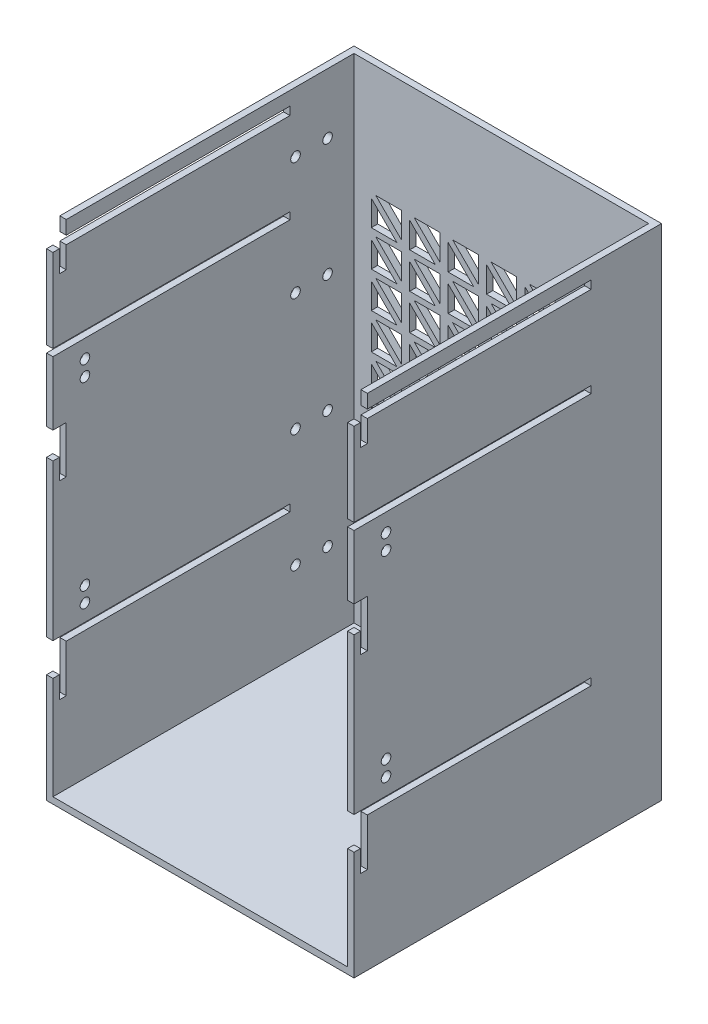
from build123d import *

# Parameters (mm, degrees)
SKETCH1_W           = 152.4
SKETCH1_H           = 152.4
BOSS_EXTRUDE1_DEPTH = 247.65
SHELL1_T            = -3.175
SKETCH3_W           = 152.4
SKETCH3_H           = 3.4798
SKETCH3_H_2         = 4.064
CUT_EXTRUDE1_DEPTH  = 117.475
SKETCH4_W           = 6.604
SKETCH4_H           = 6.7564
SKETCH4_W_2         = 3.429
SKETCH4_H_2         = 10.7696
CUT_EXTRUDE2_DEPTH  = 329.30175525
CUT_EXTRUDE3_REACH  = 330.302
SKETCH5_R           = 4.8895
CUT_EXTRUDE4_DEPTH  = 3.175
CUT_EXTRUDE5_REACH  = 330.302
SKETCH7_R           = 2.38125
SKETCH7_2_R         = 2.38125
CUT_EXTRUDE6_DEPTH  = 329.30175525
SKETCH8_R           = 2.38125
CUT_EXTRUDE8_DEPTH  = 327.839996214


with BuildPart() as part:
    # Sketch1 → Boss-Extrude1 (new body)
    with BuildSketch(Plane(origin=(0, 0, 0), x_dir=(1, 0, 0), z_dir=(0, 1, 0))):
        with Locations((76.2, 76.2)):
            Rectangle(SKETCH1_W, SKETCH1_H)
    extrude(amount=BOSS_EXTRUDE1_DEPTH)

    # Shell1
    shell1_openings = [part.faces().sort_by_distance(p)[0] for p in [
        (76.2, 247.65, -76.2),
        (76.2, 123.825, 0),
    ]]
    offset(amount=SHELL1_T, openings=shell1_openings, kind=Kind.INTERSECTION)

    # Sketch3 → Cut-Extrude1 (cut)
    with BuildSketch(Plane.XY.offset(-117.475)):
        with Locations((76.2, 68.4149)):
            Rectangle(SKETCH3_W, SKETCH3_H)
        with Locations((76.2, 238.8616)):
            Rectangle(SKETCH3_W, SKETCH3_H_2)
        with Locations((76.2, 193.8147)):
            Rectangle(SKETCH3_W, SKETCH3_H)
    extrude(amount=CUT_EXTRUDE1_DEPTH, mode=Mode.SUBTRACT)

    # Sketch4 → Cut-Extrude2 (cut, through all)
    with BuildSketch(Plane(origin=(152.4, 0, 0), x_dir=(0, 0, -1), z_dir=(1, 0, 0))):
        with Locations((3.302, 244.2718)):
            Rectangle(SKETCH4_W, SKETCH4_H)
        with Locations((4.8895, 231.4448)):
            Rectangle(SKETCH4_W_2, SKETCH4_H_2)
        Polygon((6.604, 66.675), (6.604, 43.2054), (3.175, 43.2054), (3.175, 53.975), (0, 53.975), (0, 66.675), align=None)
        Polygon((3.175, 147.32), (3.175, 137.16), (6.604, 137.16), (6.604, 160.528), (0, 160.528), (0, 147.32), align=None)
    extrude(amount=-CUT_EXTRUDE2_DEPTH, mode=Mode.SUBTRACT)

    # Sketch5 → Cut-Extrude3 (cut, up to next)
    with BuildSketch(Plane(origin=(0, 0, -152.4), x_dir=(-1, 0, 0), z_dir=(0, 0, -1)), mode=Mode.PRIVATE) as cut_extrude3_sk1:
        with Locations((-115.8748, 30.1752)):
            Circle(SKETCH5_R)
    cut_extrude3_tool1 = extrude(cut_extrude3_sk1.sketch, amount=-CUT_EXTRUDE3_REACH, mode=Mode.PRIVATE) & part.part
    add(cut_extrude3_tool1.solids().sort_by_distance((115.8748, 30.1752, -152.4))[0], mode=Mode.SUBTRACT)

    # Sketch6 → Cut-Extrude4 (cut)
    with BuildSketch(Plane.XY.offset(-149.225)):
        Polygon((140.97, 192.0748), (140.97, 179.3748), (128.27, 192.0748), align=None)
        Polygon((138.72493597, 177.12973597), (126.02493597, 189.82973597), (126.02493597, 177.12973597), align=None)
        Polygon((140.97, 174.2948), (140.97, 161.5948), (128.27, 174.2948), align=None)
        Polygon((138.72493597, 159.34973597), (126.02493597, 172.04973597), (126.02493597, 159.34973597), align=None)
        Polygon((140.97, 156.5148), (140.97, 143.8148), (128.27, 156.5148), align=None)
        Polygon((138.72493597, 141.56973597), (126.02493597, 154.26973597), (126.02493597, 141.56973597), align=None)
        Polygon((140.97, 138.7348), (140.97, 126.0348), (128.27, 138.7348), align=None)
        Polygon((138.72493597, 123.78973597), (126.02493597, 136.48973597), (126.02493597, 123.78973597), align=None)
        Polygon((140.97, 120.9548), (140.97, 108.2548), (128.27, 120.9548), align=None)
        Polygon((138.72493597, 106.00973597), (126.02493597, 118.70973597), (126.02493597, 106.00973597), align=None)
        Polygon((140.97, 103.1748), (140.97, 90.4748), (128.27, 103.1748), align=None)
        Polygon((138.72493597, 88.22973597), (126.02493597, 100.92973597), (126.02493597, 88.22973597), align=None)
        Polygon((140.97, 85.3948), (140.97, 72.6948), (128.27, 85.3948), align=None)
        Polygon((138.72493597, 70.44973597), (126.02493597, 83.14973597), (126.02493597, 70.44973597), align=None)
        Polygon((121.92, 192.0748), (121.92, 179.3748), (109.22, 192.0748), align=None)
        Polygon((119.67493597, 177.12973597), (106.97493597, 189.82973597), (106.97493597, 177.12973597), align=None)
        Polygon((121.92, 174.2948), (121.92, 161.5948), (109.22, 174.2948), align=None)
        Polygon((119.67493597, 159.34973597), (106.97493597, 172.04973597), (106.97493597, 159.34973597), align=None)
        Polygon((121.92, 156.5148), (121.92, 143.8148), (109.22, 156.5148), align=None)
        Polygon((119.67493597, 141.56973597), (106.97493597, 154.26973597), (106.97493597, 141.56973597), align=None)
        Polygon((121.92, 138.7348), (121.92, 126.0348), (109.22, 138.7348), align=None)
        Polygon((119.67493597, 123.78973597), (106.97493597, 136.48973597), (106.97493597, 123.78973597), align=None)
        Polygon((121.92, 120.9548), (121.92, 108.2548), (109.22, 120.9548), align=None)
        Polygon((119.67493597, 106.00973597), (106.97493597, 118.70973597), (106.97493597, 106.00973597), align=None)
        Polygon((121.92, 103.1748), (121.92, 90.4748), (109.22, 103.1748), align=None)
        Polygon((119.67493597, 88.22973597), (106.97493597, 100.92973597), (106.97493597, 88.22973597), align=None)
        Polygon((121.92, 85.3948), (121.92, 72.6948), (109.22, 85.3948), align=None)
        Polygon((119.67493597, 70.44973597), (106.97493597, 83.14973597), (106.97493597, 70.44973597), align=None)
        Polygon((102.87, 192.0748), (102.87, 179.3748), (90.17, 192.0748), align=None)
        Polygon((100.62493597, 177.12973597), (87.92493597, 189.82973597), (87.92493597, 177.12973597), align=None)
        Polygon((102.87, 174.2948), (102.87, 161.5948), (90.17, 174.2948), align=None)
        Polygon((100.62493597, 159.34973597), (87.92493597, 172.04973597), (87.92493597, 159.34973597), align=None)
        Polygon((102.87, 156.5148), (102.87, 143.8148), (90.17, 156.5148), align=None)
        Polygon((100.62493597, 141.56973597), (87.92493597, 154.26973597), (87.92493597, 141.56973597), align=None)
        Polygon((102.87, 138.7348), (102.87, 126.0348), (90.17, 138.7348), align=None)
        Polygon((100.62493597, 123.78973597), (87.92493597, 136.48973597), (87.92493597, 123.78973597), align=None)
        Polygon((102.87, 120.9548), (102.87, 108.2548), (90.17, 120.9548), align=None)
        Polygon((100.62493597, 106.00973597), (87.92493597, 118.70973597), (87.92493597, 106.00973597), align=None)
        Polygon((102.87, 103.1748), (102.87, 90.4748), (90.17, 103.1748), align=None)
        Polygon((100.62493597, 88.22973597), (87.92493597, 100.92973597), (87.92493597, 88.22973597), align=None)
        Polygon((102.87, 85.3948), (102.87, 72.6948), (90.17, 85.3948), align=None)
        Polygon((100.62493597, 70.44973597), (87.92493597, 83.14973597), (87.92493597, 70.44973597), align=None)
        Polygon((83.82, 192.0748), (83.82, 179.3748), (71.12, 192.0748), align=None)
        Polygon((81.57493597, 177.12973597), (68.87493597, 189.82973597), (68.87493597, 177.12973597), align=None)
        Polygon((83.82, 174.2948), (83.82, 161.5948), (71.12, 174.2948), align=None)
        Polygon((81.57493597, 159.34973597), (68.87493597, 172.04973597), (68.87493597, 159.34973597), align=None)
        Polygon((83.82, 156.5148), (83.82, 143.8148), (71.12, 156.5148), align=None)
        Polygon((81.57493597, 141.56973597), (68.87493597, 154.26973597), (68.87493597, 141.56973597), align=None)
        Polygon((83.82, 138.7348), (83.82, 126.0348), (71.12, 138.7348), align=None)
        Polygon((81.57493597, 123.78973597), (68.87493597, 136.48973597), (68.87493597, 123.78973597), align=None)
        Polygon((83.82, 120.9548), (83.82, 108.2548), (71.12, 120.9548), align=None)
        Polygon((81.57493597, 106.00973597), (68.87493597, 118.70973597), (68.87493597, 106.00973597), align=None)
        Polygon((83.82, 103.1748), (83.82, 90.4748), (71.12, 103.1748), align=None)
        Polygon((81.57493597, 88.22973597), (68.87493597, 100.92973597), (68.87493597, 88.22973597), align=None)
        Polygon((83.82, 85.3948), (83.82, 72.6948), (71.12, 85.3948), align=None)
        Polygon((81.57493597, 70.44973597), (68.87493597, 83.14973597), (68.87493597, 70.44973597), align=None)
        Polygon((64.77, 192.0748), (64.77, 179.3748), (52.07, 192.0748), align=None)
        Polygon((62.52493597, 177.12973597), (49.82493597, 189.82973597), (49.82493597, 177.12973597), align=None)
        Polygon((64.77, 174.2948), (64.77, 161.5948), (52.07, 174.2948), align=None)
        Polygon((62.52493597, 159.34973597), (49.82493597, 172.04973597), (49.82493597, 159.34973597), align=None)
        Polygon((64.77, 156.5148), (64.77, 143.8148), (52.07, 156.5148), align=None)
        Polygon((62.52493597, 141.56973597), (49.82493597, 154.26973597), (49.82493597, 141.56973597), align=None)
        Polygon((64.77, 138.7348), (64.77, 126.0348), (52.07, 138.7348), align=None)
        Polygon((62.52493597, 123.78973597), (49.82493597, 136.48973597), (49.82493597, 123.78973597), align=None)
        Polygon((64.77, 120.9548), (64.77, 108.2548), (52.07, 120.9548), align=None)
        Polygon((62.52493597, 106.00973597), (49.82493597, 118.70973597), (49.82493597, 106.00973597), align=None)
        Polygon((64.77, 103.1748), (64.77, 90.4748), (52.07, 103.1748), align=None)
        Polygon((62.52493597, 88.22973597), (49.82493597, 100.92973597), (49.82493597, 88.22973597), align=None)
        Polygon((64.77, 85.3948), (64.77, 72.6948), (52.07, 85.3948), align=None)
        Polygon((62.52493597, 70.44973597), (49.82493597, 83.14973597), (49.82493597, 70.44973597), align=None)
        Polygon((45.72, 192.0748), (45.72, 179.3748), (33.02, 192.0748), align=None)
        Polygon((43.47493597, 177.12973597), (30.77493597, 189.82973597), (30.77493597, 177.12973597), align=None)
        Polygon((45.72, 174.2948), (45.72, 161.5948), (33.02, 174.2948), align=None)
        Polygon((43.47493597, 159.34973597), (30.77493597, 172.04973597), (30.77493597, 159.34973597), align=None)
        Polygon((45.72, 156.5148), (45.72, 143.8148), (33.02, 156.5148), align=None)
        Polygon((43.47493597, 141.56973597), (30.77493597, 154.26973597), (30.77493597, 141.56973597), align=None)
        Polygon((45.72, 138.7348), (45.72, 126.0348), (33.02, 138.7348), align=None)
        Polygon((43.47493597, 123.78973597), (30.77493597, 136.48973597), (30.77493597, 123.78973597), align=None)
        Polygon((45.72, 120.9548), (45.72, 108.2548), (33.02, 120.9548), align=None)
        Polygon((43.47493597, 106.00973597), (30.77493597, 118.70973597), (30.77493597, 106.00973597), align=None)
        Polygon((45.72, 103.1748), (45.72, 90.4748), (33.02, 103.1748), align=None)
        Polygon((43.47493597, 88.22973597), (30.77493597, 100.92973597), (30.77493597, 88.22973597), align=None)
        Polygon((45.72, 85.3948), (45.72, 72.6948), (33.02, 85.3948), align=None)
        Polygon((43.47493597, 70.44973597), (30.77493597, 83.14973597), (30.77493597, 70.44973597), align=None)
        Polygon((26.67, 192.0748), (26.67, 179.3748), (13.97, 192.0748), align=None)
        Polygon((24.42493597, 177.12973597), (11.72493597, 189.82973597), (11.72493597, 177.12973597), align=None)
        Polygon((26.67, 174.2948), (26.67, 161.5948), (13.97, 174.2948), align=None)
        Polygon((24.42493597, 159.34973597), (11.72493597, 172.04973597), (11.72493597, 159.34973597), align=None)
        Polygon((26.67, 156.5148), (26.67, 143.8148), (13.97, 156.5148), align=None)
        Polygon((24.42493597, 141.56973597), (11.72493597, 154.26973597), (11.72493597, 141.56973597), align=None)
        Polygon((26.67, 138.7348), (26.67, 126.0348), (13.97, 138.7348), align=None)
        Polygon((24.42493597, 123.78973597), (11.72493597, 136.48973597), (11.72493597, 123.78973597), align=None)
        Polygon((26.67, 120.9548), (26.67, 108.2548), (13.97, 120.9548), align=None)
        Polygon((24.42493597, 106.00973597), (11.72493597, 118.70973597), (11.72493597, 106.00973597), align=None)
        Polygon((26.67, 103.1748), (26.67, 90.4748), (13.97, 103.1748), align=None)
        Polygon((24.42493597, 88.22973597), (11.72493597, 100.92973597), (11.72493597, 88.22973597), align=None)
        Polygon((26.67, 85.3948), (26.67, 72.6948), (13.97, 85.3948), align=None)
        Polygon((24.42493597, 70.44973597), (11.72493597, 83.14973597), (11.72493597, 70.44973597), align=None)
        Polygon((140.97, 60.325), (140.97, 47.625), (128.27, 60.325), align=None)
        Polygon((126.02493597, 58.07993597), (126.02493597, 45.37993597), (138.72493597, 45.37993597), align=None)
        Polygon((121.92, 60.325), (121.92, 47.625), (109.22, 60.325), align=None)
        Polygon((106.97493597, 58.07993597), (106.97493597, 45.37993597), (119.67493597, 45.37993597), align=None)
        Polygon((102.87, 60.325), (102.87, 47.625), (90.17, 60.325), align=None)
        Polygon((87.92493597, 58.07993597), (87.92493597, 45.37993597), (100.62493597, 45.37993597), align=None)
        Polygon((83.82, 60.325), (83.82, 47.625), (71.12, 60.325), align=None)
        Polygon((68.87493597, 58.07993597), (68.87493597, 45.37993597), (81.57493597, 45.37993597), align=None)
        Polygon((64.77, 60.325), (64.77, 47.625), (52.07, 60.325), align=None)
        Polygon((49.82493597, 58.07993597), (49.82493597, 45.37993597), (62.52493597, 45.37993597), align=None)
        Polygon((45.72, 60.325), (45.72, 47.625), (33.02, 60.325), align=None)
        Polygon((30.77493597, 58.07993597), (30.77493597, 45.37993597), (43.47493597, 45.37993597), align=None)
        Polygon((26.67, 60.325), (26.67, 47.625), (13.97, 60.325), align=None)
        Polygon((11.72493597, 58.07993597), (11.72493597, 45.37993597), (24.42493597, 45.37993597), align=None)
        Polygon((102.87, 41.275), (102.87, 28.575), (90.17, 41.275), align=None)
        Polygon((87.92493597, 39.02993597), (87.92493597, 26.32993597), (100.62493597, 26.32993597), align=None)
        Polygon((83.82, 41.275), (83.82, 28.575), (71.12, 41.275), align=None)
        Polygon((68.87493597, 39.02993597), (68.87493597, 26.32993597), (81.57493597, 26.32993597), align=None)
        Polygon((64.77, 41.275), (64.77, 28.575), (52.07, 41.275), align=None)
        Polygon((49.82493597, 39.02993597), (49.82493597, 26.32993597), (62.52493597, 26.32993597), align=None)
        Polygon((45.72, 41.275), (45.72, 28.575), (33.02, 41.275), align=None)
        Polygon((30.77493597, 39.02993597), (30.77493597, 26.32993597), (43.47493597, 26.32993597), align=None)
        Polygon((26.67, 41.275), (26.67, 28.575), (13.97, 41.275), align=None)
        Polygon((11.72493597, 39.02993597), (11.72493597, 26.32993597), (24.42493597, 26.32993597), align=None)
        Polygon((126.02493597, 26.32993597), (138.72493597, 26.32993597), (126.02493597, 39.02993597), align=None)
        Polygon((140.97, 28.575), (128.27, 41.275), (140.97, 41.275), align=None)
        Polygon((102.87, 22.225), (102.87, 9.525), (90.17, 22.225), align=None)
        Polygon((87.92493597, 19.97993597), (87.92493597, 7.27993597), (100.62493597, 7.27993597), align=None)
        Polygon((83.82, 22.225), (83.82, 9.525), (71.12, 22.225), align=None)
        Polygon((68.87493597, 19.97993597), (68.87493597, 7.27993597), (81.57493597, 7.27993597), align=None)
        Polygon((64.77, 22.225), (64.77, 9.525), (52.07, 22.225), align=None)
        Polygon((49.82493597, 19.97993597), (49.82493597, 7.27993597), (62.52493597, 7.27993597), align=None)
        Polygon((45.72, 22.225), (45.72, 9.525), (33.02, 22.225), align=None)
        Polygon((30.77493597, 19.97993597), (30.77493597, 7.27993597), (43.47493597, 7.27993597), align=None)
        Polygon((26.67, 22.225), (26.67, 9.525), (13.97, 22.225), align=None)
        Polygon((11.72493597, 19.97993597), (11.72493597, 7.27993597), (24.42493597, 7.27993597), align=None)
        Polygon((126.02493597, 7.27993597), (138.72493597, 7.27993597), (126.02493597, 19.97993597), align=None)
        Polygon((140.97, 9.525), (128.27, 22.225), (140.97, 22.225), align=None)
    extrude(amount=-CUT_EXTRUDE4_DEPTH, mode=Mode.SUBTRACT)

    # Sketch7 → Cut-Extrude5 (cut, up to next)
    with BuildSketch(Plane.ZY, mode=Mode.PRIVATE) as cut_extrude5_sk1:
        with Locations((-136.110990874, 217.7796)):
            Circle(SKETCH7_R)
    cut_extrude5_tool1 = extrude(cut_extrude5_sk1.sketch, amount=-CUT_EXTRUDE5_REACH, mode=Mode.PRIVATE) & part.part
    # Sketch7 → Cut-Extrude5 (cut, up to next)
    with BuildSketch(Plane.ZY, mode=Mode.PRIVATE) as cut_extrude5_sk2:
        with Locations((-120.235990874, 217.7796)):
            Circle(SKETCH7_R)
    cut_extrude5_tool2 = extrude(cut_extrude5_sk2.sketch, amount=-CUT_EXTRUDE5_REACH, mode=Mode.PRIVATE) & part.part
    # Sketch7 → Cut-Extrude5 (cut, up to next)
    with BuildSketch(Plane.ZY, mode=Mode.PRIVATE) as cut_extrude5_sk3:
        with Locations((-136.110990874, 159.3596)):
            Circle(SKETCH7_R)
    cut_extrude5_tool3 = extrude(cut_extrude5_sk3.sketch, amount=-CUT_EXTRUDE5_REACH, mode=Mode.PRIVATE) & part.part
    # Sketch7 → Cut-Extrude5 (cut, up to next)
    with BuildSketch(Plane.ZY, mode=Mode.PRIVATE) as cut_extrude5_sk4:
        with Locations((-120.235990874, 159.3596)):
            Circle(SKETCH7_R)
    cut_extrude5_tool4 = extrude(cut_extrude5_sk4.sketch, amount=-CUT_EXTRUDE5_REACH, mode=Mode.PRIVATE) & part.part
    # Sketch7 → Cut-Extrude5 (cut, up to next)
    with BuildSketch(Plane.ZY, mode=Mode.PRIVATE) as cut_extrude5_sk5:
        with Locations((-136.110990874, 100.9396)):
            Circle(SKETCH7_R)
    cut_extrude5_tool5 = extrude(cut_extrude5_sk5.sketch, amount=-CUT_EXTRUDE5_REACH, mode=Mode.PRIVATE) & part.part
    # Sketch7 → Cut-Extrude5 (cut, up to next)
    with BuildSketch(Plane.ZY, mode=Mode.PRIVATE) as cut_extrude5_sk6:
        with Locations((-120.235990874, 100.9396)):
            Circle(SKETCH7_R)
    cut_extrude5_tool6 = extrude(cut_extrude5_sk6.sketch, amount=-CUT_EXTRUDE5_REACH, mode=Mode.PRIVATE) & part.part
    # Sketch7 → Cut-Extrude5 (cut, up to next)
    with BuildSketch(Plane.ZY, mode=Mode.PRIVATE) as cut_extrude5_sk7:
        with Locations((-136.110990874, 42.5196)):
            Circle(SKETCH7_R)
    cut_extrude5_tool7 = extrude(cut_extrude5_sk7.sketch, amount=-CUT_EXTRUDE5_REACH, mode=Mode.PRIVATE) & part.part
    # Sketch7 → Cut-Extrude5 (cut, up to next)
    with BuildSketch(Plane.ZY, mode=Mode.PRIVATE) as cut_extrude5_sk8:
        with Locations((-120.235990874, 42.5196)):
            Circle(SKETCH7_R)
    cut_extrude5_tool8 = extrude(cut_extrude5_sk8.sketch, amount=-CUT_EXTRUDE5_REACH, mode=Mode.PRIVATE) & part.part
    # Sketch7 → Cut-Extrude5 (cut, up to next)
    with BuildSketch(Plane.ZY, mode=Mode.PRIVATE) as cut_extrude5_sk9:
        with Locations((-15.875, 183.1848)):
            Circle(SKETCH7_R)
    cut_extrude5_tool9 = extrude(cut_extrude5_sk9.sketch, amount=-CUT_EXTRUDE5_REACH, mode=Mode.PRIVATE) & part.part
    # Sketch7 → Cut-Extrude5 (cut, up to next)
    with BuildSketch(Plane.ZY, mode=Mode.PRIVATE) as cut_extrude5_sk10:
        with Locations((-15.875, 175.5648)):
            Circle(SKETCH7_R)
    cut_extrude5_tool10 = extrude(cut_extrude5_sk10.sketch, amount=-CUT_EXTRUDE5_REACH, mode=Mode.PRIVATE) & part.part
    # Sketch7 → Cut-Extrude5 (cut, up to next)
    with BuildSketch(Plane.ZY, mode=Mode.PRIVATE) as cut_extrude5_sk11:
        with Locations((-15.875, 78.4098)):
            Circle(SKETCH7_R)
    cut_extrude5_tool11 = extrude(cut_extrude5_sk11.sketch, amount=-CUT_EXTRUDE5_REACH, mode=Mode.PRIVATE) & part.part
    # Sketch7 → Cut-Extrude5 (cut, up to next)
    with BuildSketch(Plane.ZY, mode=Mode.PRIVATE) as cut_extrude5_sk12:
        with Locations((-15.875, 86.0298)):
            Circle(SKETCH7_R)
    cut_extrude5_tool12 = extrude(cut_extrude5_sk12.sketch, amount=-CUT_EXTRUDE5_REACH, mode=Mode.PRIVATE) & part.part
    add(cut_extrude5_tool1.solids().sort_by_distance((0, 217.7796, -136.110991))[0], mode=Mode.SUBTRACT)
    add(cut_extrude5_tool2.solids().sort_by_distance((0, 217.7796, -120.235991))[0], mode=Mode.SUBTRACT)
    add(cut_extrude5_tool3.solids().sort_by_distance((0, 159.3596, -136.110991))[0], mode=Mode.SUBTRACT)
    add(cut_extrude5_tool4.solids().sort_by_distance((0, 159.3596, -120.235991))[0], mode=Mode.SUBTRACT)
    add(cut_extrude5_tool5.solids().sort_by_distance((0, 100.9396, -136.110991))[0], mode=Mode.SUBTRACT)
    add(cut_extrude5_tool6.solids().sort_by_distance((0, 100.9396, -120.235991))[0], mode=Mode.SUBTRACT)
    add(cut_extrude5_tool7.solids().sort_by_distance((0, 42.5196, -136.110991))[0], mode=Mode.SUBTRACT)
    add(cut_extrude5_tool8.solids().sort_by_distance((0, 42.5196, -120.235991))[0], mode=Mode.SUBTRACT)
    add(cut_extrude5_tool9.solids().sort_by_distance((0, 183.1848, -15.875))[0], mode=Mode.SUBTRACT)
    add(cut_extrude5_tool10.solids().sort_by_distance((0, 175.5648, -15.875))[0], mode=Mode.SUBTRACT)
    add(cut_extrude5_tool11.solids().sort_by_distance((0, 78.4098, -15.875))[0], mode=Mode.SUBTRACT)
    add(cut_extrude5_tool12.solids().sort_by_distance((0, 86.0298, -15.875))[0], mode=Mode.SUBTRACT)

    # Sketch7<2> → Cut-Extrude6 (cut, through all)
    with BuildSketch(Plane.ZY):
        with Locations((-15.875, 183.1848)):
            Circle(SKETCH7_2_R)
        with Locations((-15.875, 175.5648)):
            Circle(SKETCH7_2_R)
        with Locations((-15.875, 78.4098)):
            Circle(SKETCH7_2_R)
        with Locations((-15.875, 86.0298)):
            Circle(SKETCH7_2_R)
    extrude(amount=-CUT_EXTRUDE6_DEPTH, mode=Mode.SUBTRACT)

    # Sketch8 → Cut-Extrude8 (cut, through all)
    with BuildSketch(Plane.XY.offset(-149.225)):
        with Locations((6.35, 68.5165)):
            Circle(SKETCH8_R)
        with Locations((6.35, 58.9915)):
            Circle(SKETCH8_R)
        with Locations((146.05, 58.9915)):
            Circle(SKETCH8_R)
        with Locations((146.05, 68.5165)):
            Circle(SKETCH8_R)
    extrude(amount=-CUT_EXTRUDE8_DEPTH, mode=Mode.SUBTRACT)


solid = part.part
